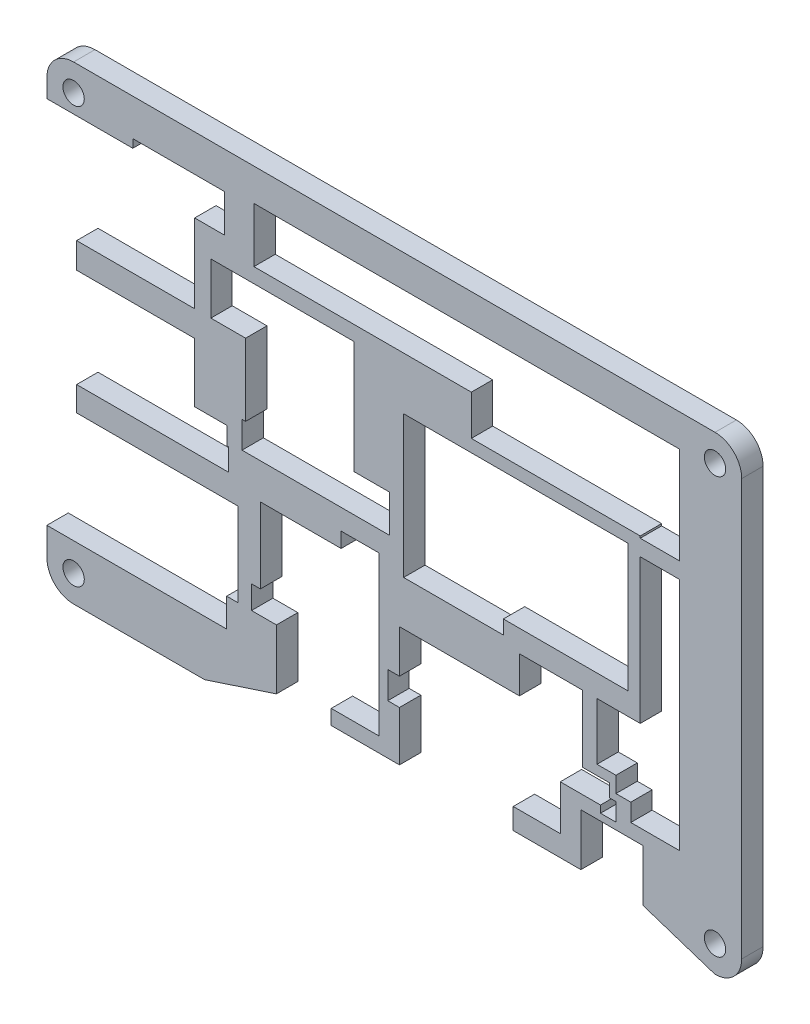
from build123d import *

# Parameters (mm, degrees)
BOSS_EXTRUDE1_OUTLINE_R = 1.3462
BOSS_EXTRUDE1_DEPTH     = 3.048
SKETCH14_W              = 2.2754
SKETCH14_H              = 2.1513
CUT_EXTRUDE2_DEPTH      = 430.898988368
SKETCH15_W              = 16.8402
SKETCH15_H              = 14.1197
SKETCH15_H_2            = 15.4101
CUT_EXTRUDE3_DEPTH      = 430.898988368
SKETCH16_R              = 1.524
CUT_EXTRUDE4_DEPTH      = 430.898988368


# Read off the part's stored shape, not the designer's step: Boss-Extrude1
with BuildPart() as part:
    # Boss-Extrude1 outline → Boss-Extrude1 (new body)
    with BuildSketch(Plane.XY):
        with BuildLine():
            ThreePointArc((-397.247125, 154.7804), (-399.946077222, 153.659592612), (-401.0571, 150.956597849))
            Line((-401.0571, 150.956597849), (-401.0571, 148.341))
            Line((-401.0571, 148.341), (-388.8032, 148.341))
            Line((-388.8032, 148.341), (-388.8032, 149.5347))
            Line((-388.8032, 149.5347), (-375.7222, 149.5347))
            Line((-375.7222, 149.5347), (-375.7222, 144.15))
            Line((-375.7222, 144.15), (-380.1672, 144.15))
            Line((-380.1672, 144.15), (-380.1672, 132.9309))
            Line((-380.1672, 132.9309), (-396.8172, 132.9309))
            Line((-396.8172, 132.9309), (-396.8172, 129.2706))
            Line((-396.8172, 129.2706), (-380.1672, 129.2706))
            Line((-380.1672, 129.2706), (-380.1672, 120.8224))
            Line((-380.1672, 120.8224), (-375.3812, 120.8224))
            Line((-375.3812, 120.8224), (-375.3812, 118.2824))
            Line((-375.3812, 118.2824), (-375.1272, 118.2824))
            Line((-375.1272, 118.2824), (-375.1272, 115.1509))
            Line((-375.1272, 115.1509), (-396.8172, 115.1509))
            Line((-396.8172, 115.1509), (-396.8172, 111.6447))
            Line((-396.8172, 111.6447), (-373.7775, 111.6447))
            Line((-373.7775, 111.6447), (-373.7775, 99.7089))
            Line((-373.7775, 99.7089), (-375.4172, 99.7089))
            Line((-375.4172, 99.7089), (-375.4172, 95.6449))
            Line((-375.4172, 95.6449), (-401.0571, 95.6449))
            Line((-401.0571, 95.6449), (-401.0571, 91.659304166))
            ThreePointArc((-401.0571, 91.659304166), (-399.951018769, 88.947400452), (-397.2472, 87.8217))
            Line((-397.2472, 87.8217), (-378.5565, 87.8217))
            Line((-378.5565, 87.8217), (-368.3165, 91.1883))
            Line((-368.3165, 91.1883), (-368.3165, 99.7089))
            Line((-368.3165, 99.7089), (-371.8725, 99.7089))
            Line((-371.8725, 99.7089), (-371.8725, 103.0109))
            Line((-371.8725, 103.0109), (-370.6025, 103.0109))
            Line((-370.6025, 103.0109), (-370.6025, 113.7612))
            Line((-370.6025, 113.7612), (-356.8152, 113.7612))
            Line((-356.8152, 113.7612), (-356.8152, 115.9125))
            Line((-356.8152, 115.9125), (-353.6872, 115.9125))
            Line((-353.6872, 115.9125), (-353.6872, 93.3059))
            Line((-353.6872, 93.3059), (-360.5003, 93.3059))
            Line((-360.5003, 93.3059), (-360.5003, 91.1883))
            Line((-360.5003, 91.1883), (-350.7686, 91.1883))
            Line((-350.7686, 91.1883), (-350.7686, 98.2843))
            Line((-350.7686, 98.2843), (-352.4372, 98.2843))
            Line((-352.4372, 98.2843), (-352.4372, 102.1451))
            Line((-352.4372, 102.1451), (-350.7686, 102.1451))
            Line((-350.7686, 102.1451), (-350.7686, 108.2665))
            Line((-350.7686, 108.2665), (-333.6613, 108.2665))
            Line((-333.6613, 108.2665), (-333.6613, 113.4801))
            Line((-333.6613, 113.4801), (-324.6295, 113.4801))
            Line((-324.6295, 113.4801), (-324.6295, 103.9551))
            Line((-324.6295, 103.9551), (-320.8233, 103.9551))
            Line((-320.8233, 103.9551), (-320.8233, 102.0978))
            Line((-320.8233, 102.0978), (-319.8913, 102.0978))
            Line((-319.8913, 102.0978), (-319.8913, 99.5578))
            Line((-319.8913, 99.5578), (-322.0933, 99.5578))
            Line((-322.0933, 99.5578), (-322.0933, 100.5738))
            Line((-322.0933, 100.5738), (-327.8337, 100.5738))
            Line((-327.8337, 100.5738), (-327.8337, 94.1717))
            Line((-327.8337, 94.1717), (-334.5393, 94.1717))
            Line((-334.5393, 94.1717), (-334.5393, 91.1883))
            Line((-334.5393, 91.1883), (-324.8873, 91.1883))
            Line((-324.8873, 91.1883), (-324.8873, 98.5911))
            Line((-324.8873, 98.5911), (-315.9973, 98.5911))
            Line((-315.9973, 98.5911), (-315.9973, 91.1883))
            Line((-315.9973, 91.1883), (-305.7573, 87.8217))
            ThreePointArc((-305.7573, 87.8217), (-303.063223164, 88.937623164), (-301.9473, 91.6317))
            Line((-301.9473, 91.6317), (-301.9473, 150.9704))
            ThreePointArc((-301.9473, 150.9704), (-303.063223164, 153.664476836), (-305.7573, 154.7804))
            Line((-305.7573, 154.7804), (-397.247125, 154.7804))
        make_face()
        with Locations((-397.2472, 91.6317)):
            Circle(BOSS_EXTRUDE1_OUTLINE_R, mode=Mode.SUBTRACT)
        with Locations((-305.7573, 91.6317)):
            Circle(BOSS_EXTRUDE1_OUTLINE_R, mode=Mode.SUBTRACT)
        Polygon((-322.5975, 105.3521), (-322.5975, 113.4801), (-316.4253, 113.4801), (-316.4253, 134.0739), (-310.8373, 134.0739), (-310.8373, 100.5738), (-317.7753, 100.5738), (-317.7753, 103.0869), (-319.8913, 103.0869), (-319.8913, 105.3521), align=None, mode=Mode.SUBTRACT)
        Polygon((-372.7142, 122.6512), (-372.7142, 132.9309), (-377.6672, 132.9309), (-377.6672, 140.2451), (-357.2832, 140.2451), (-357.2832, 124.1751), (-352.2032, 124.1751), (-352.2032, 118.8412), (-373.2222, 118.8412), (-373.2222, 122.6512), align=None, mode=Mode.SUBTRACT)
        with Locations((-397.247125, 150.9704)):
            Circle(BOSS_EXTRUDE1_OUTLINE_R, mode=Mode.SUBTRACT)
        Polygon((-335.9473, 116.6297), (-335.9473, 114.6425), (-350.1712, 114.6425), (-350.1712, 134.8668), (-318.2033, 134.8668), (-318.2033, 116.6297), align=None, mode=Mode.SUBTRACT)
        Polygon((-310.8374, 136.3599), (-316.4253, 136.3599), (-316.4253, 136.6448), (-340.5193, 136.6448), (-340.5193, 142.3597), (-371.5305, 142.3597), (-371.5305, 150.1697), (-310.8373, 150.1697), align=None, mode=Mode.SUBTRACT)
        with Locations((-305.7573, 150.9704)):
            Circle(BOSS_EXTRUDE1_OUTLINE_R, mode=Mode.SUBTRACT)
    extrude(amount=BOSS_EXTRUDE1_DEPTH)

    # Sketch14 → Cut-Extrude2 (cut, through all)
    with BuildSketch(Plane(origin=(0, 0, 0), x_dir=(-1, 0, 0), z_dir=(0, 0, -1))):
        with Locations((357.9529, 114.83685)):
            Rectangle(SKETCH14_W, SKETCH14_H)
    extrude(amount=-CUT_EXTRUDE2_DEPTH, mode=Mode.SUBTRACT)

    # Sketch15 → Cut-Extrude3 (cut, through all)
    with BuildSketch(Plane(origin=(0, 0, 0), x_dir=(-1, 0, 0), z_dir=(0, 0, -1))):
        with Locations((388.3971, 122.21075)):
            Rectangle(SKETCH15_W, SKETCH15_H)
        with Locations((388.3971, 140.63595)):
            Rectangle(SKETCH15_W, SKETCH15_H_2)
    extrude(amount=-CUT_EXTRUDE3_DEPTH, mode=Mode.SUBTRACT)

    # Sketch16 → Cut-Extrude4 (cut, through all)
    with BuildSketch(Plane.XY.offset(3.048)):
        with Locations((-397.247125, 150.9704)):
            Circle(SKETCH16_R)
        with Locations((-305.7573, 150.9704)):
            Circle(SKETCH16_R)
        with Locations((-305.7573, 91.6317)):
            Circle(SKETCH16_R)
        with Locations((-397.2472, 91.6317)):
            Circle(SKETCH16_R)
    extrude(amount=-CUT_EXTRUDE4_DEPTH, mode=Mode.SUBTRACT)


solid = part.part
